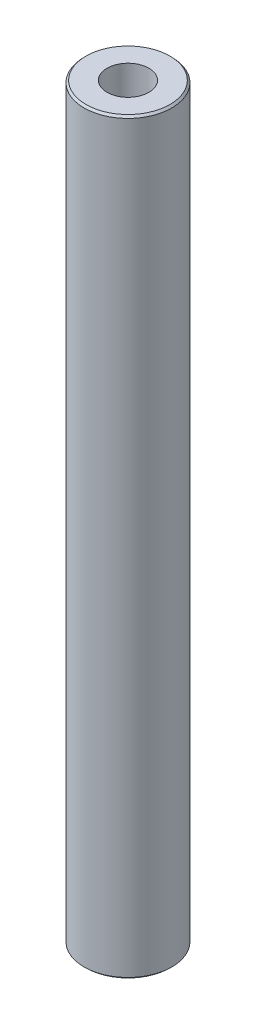
from build123d import *
from OCP.BRepFilletAPI import BRepFilletAPI_MakeChamfer

# Parameters (mm, degrees)
SKETCH1_R           = 32.5
BOSS_EXTRUDE1_DEPTH = 554.067737339
SKETCH2_R           = 15.508794126
CUT_EXTRUDE1_DEPTH  = 556.970824379
CHAMFER1_SIZE       = 1.512513975
CHAMFER1_SIZE2      = 1.397563757


with BuildPart() as part:
    # Sketch1 → Boss-Extrude1 (new body)
    with BuildSketch(Plane(origin=(0, 0, 0), x_dir=(1, 0, 0), z_dir=(0, 1, 0))):
        Circle(SKETCH1_R)
    extrude(amount=BOSS_EXTRUDE1_DEPTH)

    # Sketch2 → Cut-Extrude1 (cut, through all)
    with BuildSketch(Plane(origin=(0, 0, 0), x_dir=(1, 0, 0), z_dir=(0, 1, 0))):
        Circle(SKETCH2_R)
    extrude(amount=CUT_EXTRUDE1_DEPTH, mode=Mode.SUBTRACT)

    # Chamfer1: one chamfer whose edges measure the first distance from different faces: ONE call of the kernel's chamfer builder (chamfer() names one face for all edges)
    chamfer1_edges_1 = [part.edges().sort_by_distance(p)[0] for p in [
        (-32.5, 554.067737339, 0),
    ]]
    chamfer1_side_1 = [part.faces().sort_by_distance(p)[0] for p in [
        (-32.5, 277.03386867, 0),
    ]]
    chamfer1_edges_2 = [part.edges().sort_by_distance(p)[0] for p in [
        (-32.5, 0, 0),
    ]]
    chamfer1_side_2 = [part.faces().sort_by_distance(p)[0] for p in [
        (-31.580761184, 0, 0),
    ]]
    chamfer1 = BRepFilletAPI_MakeChamfer(part.part.solid().wrapped)
    for e in chamfer1_edges_1:
        chamfer1.Add(CHAMFER1_SIZE, CHAMFER1_SIZE2, e.wrapped, chamfer1_side_1[0].wrapped)  # the first distance lies on this face
    for e in chamfer1_edges_2:
        chamfer1.Add(CHAMFER1_SIZE, CHAMFER1_SIZE2, e.wrapped, chamfer1_side_2[0].wrapped)  # the first distance lies on this face
    add(Compound.cast(chamfer1.Shape()), mode=Mode.REPLACE)


solid = part.part
